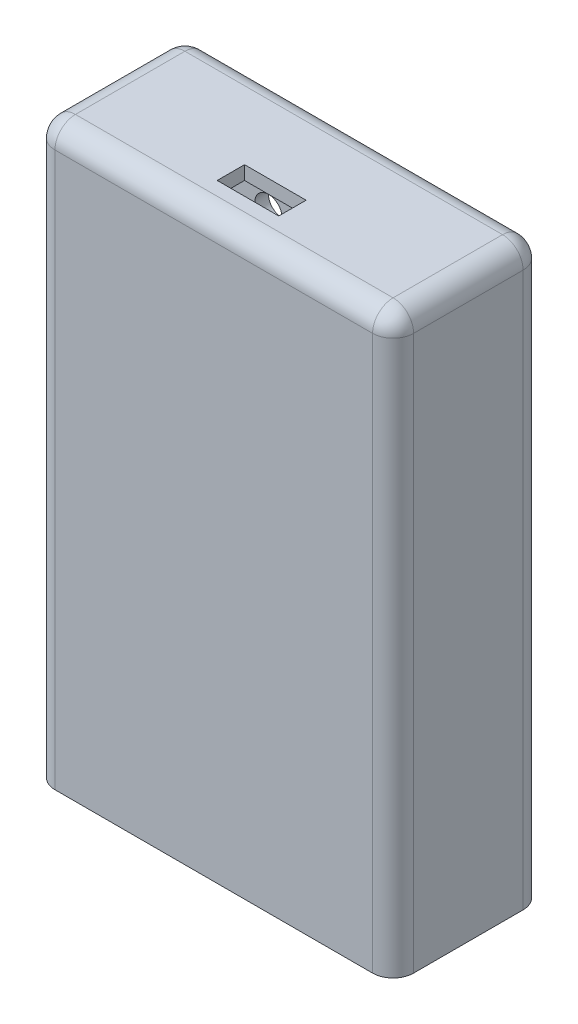
from build123d import *

# Parameters (mm, degrees)
BOSS_EXTRUDE1_DEPTH = 20
SKETCH3_W           = 26.2190054
SKETCH3_H           = 11
SKETCH3_W_2         = 24
SKETCH3_H_2         = 9
BOSS_EXTRUDE2_DEPTH = 21
SKETCH4_W           = 26.2190054
SKETCH4_H           = 11
BOSS_EXTRUDE3_DEPTH = 1
SKETCH5_W           = 4.5
SKETCH5_H           = 2
CUT_EXTRUDE1_DEPTH  = 44.795574861
FILLET1_R           = 1.5
FILLET2_R           = 1.5
FILLET3_R           = 1.5
SKETCH6_R           = 1
CUT_EXTRUDE2_DEPTH  = 1


with BuildPart() as part:
    # Sketch1 → Boss-Extrude1 (new body)
    with BuildSketch(Plane(origin=(0, 0, 0), x_dir=(1, 0, 0), z_dir=(0, 1, 0))):
        Polygon((13.1095027, 8.074237819), (-13.1095027, 8.074237819), (-13.1095027, 0.574237819), (-13.1095027, -2.925762181), (-10.25, -2.925762181), (10.25, -2.925762181), (13.1095027, -2.925762181), (13.1095027, 0.574237819), align=None)
        Polygon((-10.25, 0.574237819), (-10.25, 1.574237819), (-9.25, 1.574237819), (-9.25, 2.574237819), (-12, 2.574237819), (-12, 7.074237819), (12, 7.074237819), (12, 2.574237819), (9.25, 2.574237819), (9.25, 1.574237819), (10.25, 1.574237819), (10.25, 0.574237819), (10.25, -0.425762181), (9.25, -0.425762181), (9.25, -1.425762181), (9.25, -1.925762181), (-9.25, -1.925762181), (-9.25, -1.425762181), (-9.25, -0.425762181), (-10.25, -0.425762181), align=None, mode=Mode.SUBTRACT)
    extrude(amount=BOSS_EXTRUDE1_DEPTH)

    # Sketch3 → Boss-Extrude2 (add)
    with BuildSketch(Plane.XZ):
        with Locations((0, -2.574237819)):
            Rectangle(SKETCH3_W, SKETCH3_H)
        with Locations((0, -2.574237819)):
            Rectangle(SKETCH3_W_2, SKETCH3_H_2, mode=Mode.SUBTRACT)
    extrude(amount=BOSS_EXTRUDE2_DEPTH)

    # Sketch4 → Boss-Extrude3 (add)
    with BuildSketch(Plane(origin=(0, 20, 0), x_dir=(1, 0, 0), z_dir=(0, 1, 0))):
        with Locations((0, 2.574237819)):
            Rectangle(SKETCH4_W, SKETCH4_H)
    extrude(amount=BOSS_EXTRUDE3_DEPTH)

    # Sketch5 → Cut-Extrude1 (cut, through all)
    with BuildSketch(Plane.XZ.offset(-20)):
        with Locations((0, -0.574237819)):
            Rectangle(SKETCH5_W, SKETCH5_H)
    extrude(amount=-CUT_EXTRUDE1_DEPTH, mode=Mode.SUBTRACT)

    # Fillet1
    fillet1_edges = [part.edges().sort_by_distance(p)[0] for p in [
        (13.1095027, 0, -8.074237819),
        (12, -0.5, -7.074237819),
        (-12, -0.5, -7.074237819),
        (-13.1095027, 0, -8.074237819),
        (13.1095027, 0, 2.925762181),
        (12, -10.5, 1.925762181),
        (-13.1095027, 0, 2.925762181),
        (-12, -10.5, 1.925762181),
    ]]
    fillet(fillet1_edges, radius=FILLET1_R)

    # Fillet2
    fillet2_edges = [part.edges().sort_by_distance(p)[0] for p in [
        (12, 20, -4.074237819),
        (11.560660172, 20, -6.63489799),
        (-12, 20, -4.074237819),
        (-11.560660172, 20, -6.63489799),
        (-12.670162872, 21, 2.486422353),
        (-13.1095027, 21, -2.574237819),
        (-12.670162872, 21, -7.63489799),
        (0, 21, -8.074237819),
        (12.670162872, 21, -7.63489799),
        (13.1095027, 21, -2.574237819),
        (12.670162872, 21, 2.486422353),
        (0, 20, 1.925762181),
        (0, 20, -7.074237819),
        (0, 21, 2.925762181),
    ]]
    fillet(fillet2_edges, radius=FILLET2_R - 0.0001)  # a hair under: the kernel refuses the full size

    # Fillet3
    fillet3_edges = [part.edges().sort_by_distance(p)[0] for p in [
        (9.87505, 20, -2.574237819),
        (11.560689461, 19.560689461, -2.574237819),
        (-9.87505, 20, -2.574237819),
        (-11.560689461, 19.560689461, -2.574237819),
        (12, 9.25005, -2.574237819),
        (-12, 9.25005, -2.574237819),
    ]]
    fillet(fillet3_edges, radius=FILLET3_R - 0.0001)  # a hair under: the kernel refuses the full size

    # Sketch6 → Cut-Extrude2 (cut)
    with BuildSketch(Plane(origin=(0, 0, -8.074237819), x_dir=(-1, 0, 0), z_dir=(0, 0, -1))):
        with Locations((0, 9.5)):
            Circle(SKETCH6_R)
        with Locations((3, 9.5)):
            Circle(SKETCH6_R)
        with Locations((6, 9.5)):
            Circle(SKETCH6_R)
        with Locations((9, 9.5)):
            Circle(SKETCH6_R)
        with Locations((-3, 9.5)):
            Circle(SKETCH6_R)
        with Locations((-6, 9.5)):
            Circle(SKETCH6_R)
        with Locations((-9, 9.5)):
            Circle(SKETCH6_R)
        with Locations((-1.5, 11.5)):
            Circle(SKETCH6_R)
        with Locations((1.5, 11.5)):
            Circle(SKETCH6_R)
        with Locations((4.5, 11.5)):
            Circle(SKETCH6_R)
        with Locations((7.5, 11.5)):
            Circle(SKETCH6_R)
        with Locations((-4.5, 11.5)):
            Circle(SKETCH6_R)
        with Locations((-7.5, 11.5)):
            Circle(SKETCH6_R)
        with Locations((-7.5, 7.5)):
            Circle(SKETCH6_R)
        with Locations((-4.5, 7.5)):
            Circle(SKETCH6_R)
        with Locations((-1.5, 7.5)):
            Circle(SKETCH6_R)
        with Locations((1.5, 7.5)):
            Circle(SKETCH6_R)
        with Locations((4.5, 7.5)):
            Circle(SKETCH6_R)
        with Locations((7.5, 7.5)):
            Circle(SKETCH6_R)
        with Locations((6, 13.5)):
            Circle(SKETCH6_R)
        with Locations((3, 13.5)):
            Circle(SKETCH6_R)
        with Locations((0, 13.5)):
            Circle(SKETCH6_R)
        with Locations((-3, 13.5)):
            Circle(SKETCH6_R)
        with Locations((-6, 13.5)):
            Circle(SKETCH6_R)
        with Locations((-4.5, 15.5)):
            Circle(SKETCH6_R)
        with Locations((-1.5, 15.5)):
            Circle(SKETCH6_R)
        with Locations((1.5, 15.5)):
            Circle(SKETCH6_R)
        with Locations((4.5, 15.5)):
            Circle(SKETCH6_R)
        with Locations((0, 17.5)):
            Circle(SKETCH6_R)
        with Locations((3, 17.5)):
            Circle(SKETCH6_R)
        with Locations((-3, 17.5)):
            Circle(SKETCH6_R)
        with Locations((-6, 5.5)):
            Circle(SKETCH6_R)
        with Locations((-3, 5.5)):
            Circle(SKETCH6_R)
        with Locations((0, 5.5)):
            Circle(SKETCH6_R)
        with Locations((3, 5.5)):
            Circle(SKETCH6_R)
        with Locations((6, 5.5)):
            Circle(SKETCH6_R)
        with Locations((-4.5, 3.5)):
            Circle(SKETCH6_R)
        with Locations((-1.5, 3.5)):
            Circle(SKETCH6_R)
        with Locations((1.5, 3.5)):
            Circle(SKETCH6_R)
        with Locations((4.5, 3.5)):
            Circle(SKETCH6_R)
        with Locations((0, 1.5)):
            Circle(SKETCH6_R)
        with Locations((3, 1.5)):
            Circle(SKETCH6_R)
        with Locations((-3, 1.5)):
            Circle(SKETCH6_R)
    extrude(amount=-CUT_EXTRUDE2_DEPTH, mode=Mode.SUBTRACT)


solid = part.part
